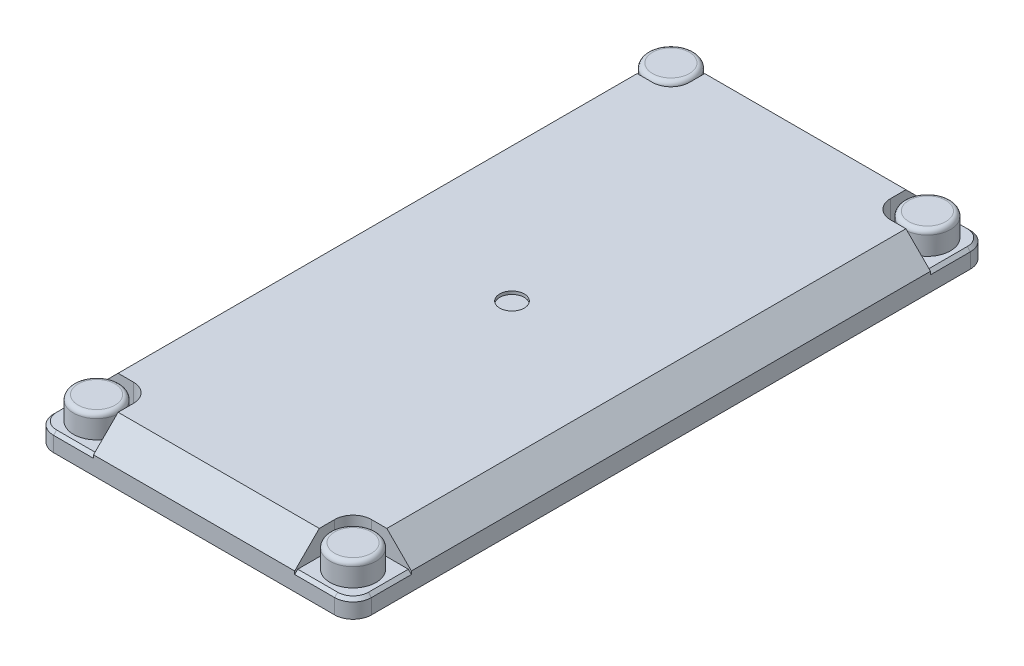
from build123d import *

# Parameters (mm, degrees)
CROQUIS1_W               = 20.7
CROQUIS1_H               = 41.4
SALIENTE_EXTRUIR1_DEPTH  = 2.78
CHAFL_N1_SIZE            = 1.6
CROQUIS4_R               = 0.8
CORTAR_EXTRUIR2_DEPTH    = 0.2
REDONDEO5_R              = 1.2
CORTAR_EXTRUIR5_DEPTH    = 1.6
CHAFL_N2_SIZE            = 0.2
CROQUIS10_R              = 1.5
SALIENTE_EXTRUIR2_DEPTH  = 1.5
REDONDEO6_R              = 0.3
REDONDEO6_OF_SIMETR_A1_R = 0.3


# Read off the part's stored shape, not the designer's step: Simetría4
with BuildPart() as part:
    # Croquis1 → Saliente-Extruir1 (new body)
    with BuildSketch(Plane(origin=(0, 0, 0), x_dir=(1, 0, 0), z_dir=(0, 1, 0))):
        Rectangle(CROQUIS1_W, CROQUIS1_H)
    extrude(amount=SALIENTE_EXTRUIR1_DEPTH)

    # Chaflán1
    chafl_n1_edges = [part.edges().sort_by_distance(p)[0] for p in [
        (-10.35, 2.78, 0),
        (0, 2.78, 20.7),
        (10.35, 2.78, 0),
        (0, 2.78, -20.7),
    ]]
    chamfer(chafl_n1_edges, length=CHAFL_N1_SIZE)

    # Croquis4 → Cortar-Extruir2 (cut)
    with BuildSketch(Plane(origin=(0, 2.78, 0), x_dir=(1, 0, 0), z_dir=(0, 1, 0))):
        with Locations(Location((0, 0, 0), (0, 0, 270))):
            Circle(CROQUIS4_R)
    extrude(amount=-CORTAR_EXTRUIR2_DEPTH, mode=Mode.SUBTRACT)

    # Redondeo5
    redondeo5_edges = [part.edges().sort_by_distance(p)[0] for p in [
        (10.35, 0.59, 20.7),
        (-10.35, 0.59, 20.7),
        (-10.35, 0.59, -20.7),
        (10.35, 0.59, -20.7),
    ]]
    fillet(redondeo5_edges, radius=REDONDEO5_R)

    # Croquis8 → Cortar-Extruir5 (cut)
    with BuildSketch(Plane(origin=(0, 2.78, 0), x_dir=(1, 0, 0), z_dir=(0, 1, 0))):
        with BuildLine():
            Line((-10.35, -20.7), (-6.55, -20.7))
            Line((-6.55, -20.7), (-6.55, -18.1))
            ThreePointArc((-6.55, -18.1), (-6.901471863, -17.251471863), (-7.75, -16.9))
            Line((-7.75, -16.9), (-10.35, -16.9))
            Line((-10.35, -16.9), (-10.35, -20.7))
        make_face()
        with BuildLine():
            Line((6.55, -20.7), (6.55, -18.1))
            ThreePointArc((6.55, -18.1), (6.901471863, -17.251471863), (7.75, -16.9))
            Line((7.75, -16.9), (10.35, -16.9))
            Line((10.35, -16.9), (10.35, -20.7))
            Line((10.35, -20.7), (6.55, -20.7))
        make_face()
        with BuildLine():
            Line((10.35, 20.7), (6.55, 20.7))
            Line((6.55, 20.7), (6.55, 18.1))
            ThreePointArc((6.55, 18.1), (6.901471863, 17.251471863), (7.75, 16.9))
            Line((7.75, 16.9), (10.35, 16.9))
            Line((10.35, 16.9), (10.35, 20.7))
        make_face()
        with BuildLine():
            Line((-6.55, 20.7), (-6.55, 18.1))
            ThreePointArc((-6.55, 18.1), (-6.901471863, 17.251471863), (-7.75, 16.9))
            Line((-7.75, 16.9), (-10.35, 16.9))
            Line((-10.35, 16.9), (-10.35, 20.7))
            Line((-10.35, 20.7), (-6.55, 20.7))
        make_face()
    extrude(amount=-CORTAR_EXTRUIR5_DEPTH, mode=Mode.SUBTRACT)

    # Chaflán2
    # the kernel refuses this chamfer: 0.2 mm, written as the material it takes off along each edge
    with BuildSketch(Plane(origin=(9.15, 1.18, -19.5), x_dir=(1, 0, 0), z_dir=(0, 0, 1))) as chafl_n2_piece_1:
        Polygon((1.2, -CHAFL_N2_SIZE), (1.2 - CHAFL_N2_SIZE, 0), (1.2, 0), align=None)
    revolve(axis=Axis((9.15, 1.18, -19.5), (0, 1, 0)), revolution_arc=90, mode=Mode.SUBTRACT)
    with BuildSketch(Plane(origin=(9.15, 1.18, -20.7), x_dir=(0, -0.999621916911297, -0.027495876610578732), z_dir=(-1, 0, 0)), Plane(origin=(-10.35, 1.18, -19.5), x_dir=(-0.02749587661058736, -0.9996219169112966, 0), z_dir=(0, 0, 1)), Plane(origin=(-6.55, 1.18, -20.7), x_dir=(0, -0.999621916911297, -0.027495876610578732), z_dir=(-1, 0, 0)), Plane(origin=(10.35, 1.18, -16.9), x_dir=(0.02749587661058736, -0.9996219169112966, 0), z_dir=(0, 0, -1)), Plane(origin=(6.55, 1.18, 20.7), x_dir=(0, -0.999621916911297, 0.027495876610578732), z_dir=(1, 0, 0)), Plane(origin=(-9.15, 1.18, 20.7), x_dir=(0, -0.999621916911297, 0.027495876610578732), z_dir=(1, 0, 0))) as chafl_n2_piece_2:
        Polygon((CHAFL_N2_SIZE * 0.999621916911, CHAFL_N2_SIZE * 0.0274958766106), (-CHAFL_N2_SIZE * 0.0274958766106, CHAFL_N2_SIZE * 0.999621916911), (0, 0), align=None)
    extrude(amount=2.6, mode=Mode.SUBTRACT)
    with BuildSketch(Plane(origin=(-9.15, 1.18, -19.5), x_dir=(0, 0, -1), z_dir=(1, 0, 0))) as chafl_n2_piece_3:
        Polygon((1.2, -CHAFL_N2_SIZE), (1.2 - CHAFL_N2_SIZE, 0), (1.2, 0), align=None)
    revolve(axis=Axis((-9.15, 1.18, -19.5), (0, 1, 0)), revolution_arc=90, mode=Mode.SUBTRACT)
    with BuildSketch(Plane(origin=(-10.35, 1.18, 16.9), x_dir=(0.9996219169112966, 0.02749587661058634, 0), z_dir=(0, 0, 1)), Plane(origin=(10.35, 1.18, 19.5), x_dir=(-0.9996219169112966, 0.02749587661058634, 0), z_dir=(0, 0, -1))) as chafl_n2_piece_4:
        Polygon((CHAFL_N2_SIZE * 0.999621916911, -CHAFL_N2_SIZE * 0.0274958766106), (-CHAFL_N2_SIZE * 0.0274958766106, -CHAFL_N2_SIZE * 0.999621916911), (0, 0), align=None)
    extrude(amount=2.6, mode=Mode.SUBTRACT)
    with BuildSketch(Plane(origin=(-9.15, 1.18, 19.5), x_dir=(-1, 0, 0), z_dir=(0, 0, -1))) as chafl_n2_piece_5:
        Polygon((1.2 - CHAFL_N2_SIZE, 0), (1.2, -CHAFL_N2_SIZE), (1.2, 0), align=None)
    revolve(axis=Axis((-9.15, 1.18, 19.5), (0, 1, 0)), revolution_arc=90, mode=Mode.SUBTRACT)
    with BuildSketch(Plane(origin=(9.15, 1.18, 19.5), x_dir=(0, 0, 1), z_dir=(-1, 0, 0))) as chafl_n2_piece_6:
        Polygon((1.2 - CHAFL_N2_SIZE, 0), (1.2, -CHAFL_N2_SIZE), (1.2, 0), align=None)
    revolve(axis=Axis((9.15, 1.18, 19.5), (0, 1, 0)), revolution_arc=90, mode=Mode.SUBTRACT)

    # Croquis10 → Saliente-Extruir2 (add)
    with BuildSketch(Plane(origin=(0, 1.18, 0), x_dir=(1, 0, 0), z_dir=(0, 1, 0))):
        with Locations(Location((-8.35, -18.7, 0), (0, 0, 90))):
            Circle(CROQUIS10_R)
    saliente_extruir2 = extrude(amount=SALIENTE_EXTRUIR2_DEPTH)

    # Redondeo6
    redondeo6_edges = [part.edges().sort_by_distance(p)[0] for p in [
        (-8.35, 2.68, 20.2),
    ]]
    fillet(redondeo6_edges, radius=REDONDEO6_R)

    # Simetría1: Saliente-Extruir2 across plane
    add(saliente_extruir2.mirror(Plane(origin=(0, 0, 0), x_dir=(0, 0, 1), z_dir=(1, 0, 0))))

    # Redondeo6 of Simetría1
    redondeo6_of_simetr_a1_edges = [part.edges().sort_by_distance(p)[0] for p in [
        (8.35, 2.68, 20.2),
    ]]
    fillet(redondeo6_of_simetr_a1_edges, radius=REDONDEO6_OF_SIMETR_A1_R)

    # Simetría4 outline → Simetría4 (revolve)
    with BuildSketch(Plane(origin=(8.35, 0, -18.7), x_dir=(1, 0, 0), z_dir=(0, 0, 1))):
        with BuildLine():
            Line((1.2, 2.68), (0, 2.68))
            Line((0, 2.68), (0, 1.18))
            Line((0, 1.18), (1.5, 1.18))
            Line((1.5, 1.18), (1.5, 2.38))
            ThreePointArc((1.5, 2.38), (1.412132034, 2.592132034), (1.2, 2.68))
        make_face()
    revolve(axis=Axis((8.35, 0, -18.7), (0, 1, 0)))

    # Simetr_a4 2 outline → Simetr_a4 2 (revolve)
    with BuildSketch(Plane(origin=(-8.35, 0, -18.7), x_dir=(1, 0, 0), z_dir=(0, 0, 1))):
        with BuildLine():
            Line((1.2, 2.68), (0, 2.68))
            Line((0, 2.68), (0, 1.18))
            Line((0, 1.18), (1.5, 1.18))
            Line((1.5, 1.18), (1.5, 2.38))
            ThreePointArc((1.5, 2.38), (1.412132034, 2.592132034), (1.2, 2.68))
        make_face()
    revolve(axis=Axis((-8.35, 0, -18.7), (0, 1, 0)))


solid = part.part
